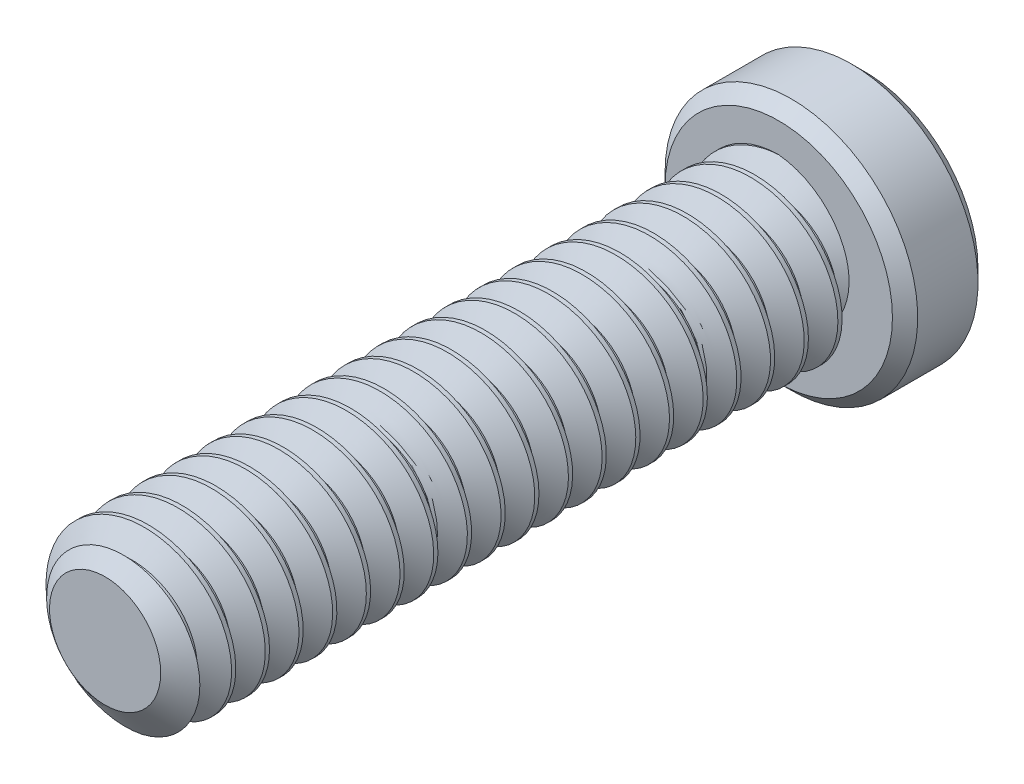
from build123d import *

# Parameters (mm, degrees)
SKETCH1_R          = 3.175
EXTRUDE1_DEPTH     = 25.4
CUT_SWEEP1_PITCH   = 1.27
SKETCH6_R          = 4.7625
EXTRUDE2_DEPTH     = 3.2258
CUT_EXTRUDE1_DEPTH = 2.38125
CHAMFER1_SIZE      = 0.47625


with BuildPart() as part:
    # Sketch1 → Extrude1 (new body)
    with BuildSketch(Plane.XY):
        Circle(SKETCH1_R)
    extrude(amount=-EXTRUDE1_DEPTH)

    # Cut-Sweep1: the profile of Sketch3 profile screwed along a right-hand helix of 21 turns, 6 arcs to a turn; built about Z, then put on its axis
    cut_sweep1_z = Axis((0, 0, 0), (0, 0, 1))
    cut_sweep1_corners = [(3.1753, 0, -1.111423205), (2.350110803, 0, -0.635), (2.350110803, 0, -0.47625), (3.1753, 0, 0.000173205)]
    with BuildLine(mode=Mode.PRIVATE) as cut_sweep1_profile:
        Line(cut_sweep1_corners[0], cut_sweep1_corners[1])
        Line(cut_sweep1_corners[1], cut_sweep1_corners[2])
        Line(cut_sweep1_corners[2], cut_sweep1_corners[3])
        Line(cut_sweep1_corners[3], cut_sweep1_corners[0])
    cut_sweep1_cap = Face(cut_sweep1_profile.wire())
    cut_sweep1_turn_angles = [0, 30, 60, 90, 120, 150, 180, 210, 240, 270, 300, 330, 360]
    cut_sweep1_turn_weights = [1, 0.8660254037844387, 1, 0.8660254037844387, 1, 0.8660254037844387, 1, 0.8660254037844387, 1, 0.8660254037844387, 1, 0.8660254037844387, 1]
    cut_sweep1_turn_rails = [Edge.make_bspline([Vector(p[0], p[1], 0).rotate(cut_sweep1_z, cut_sweep1_turn_angles[k]) / cut_sweep1_turn_weights[k] + Vector(0, 0, p[2] + CUT_SWEEP1_PITCH * cut_sweep1_turn_angles[k] / 360) for k in range(13)], [0, 0, 0, 1, 1, 2, 2, 3, 3, 4, 4, 5, 5, 6, 6, 6], 2, cut_sweep1_turn_weights) for p in cut_sweep1_corners]
    cut_sweep1_turn_sides = [Face.make_surface_from_curves(cut_sweep1_turn_rails[p[0]], cut_sweep1_turn_rails[p[1]]) for p in [(0, 1), (1, 2), (2, 3), (3, 0)]]
    cut_sweep1 = Plane(origin=(0, 0, 0), x_dir=(0, 1, 0), z_dir=(0, 0, -1)) * Solid(Shell([*[p.moved(Location((0, 0, CUT_SWEEP1_PITCH * i))) for i in range(21) for p in cut_sweep1_turn_sides], cut_sweep1_cap, cut_sweep1_cap.rotate(cut_sweep1_z, 7560).moved(Location((0, 0, CUT_SWEEP1_PITCH * 7560 / 360)))]))
    add(cut_sweep1, mode=Mode.SUBTRACT)

    # Sketch4 → Cut-Revolve1 (revolve, cut)
    with BuildSketch(Plane(origin=(0, 0, 0), x_dir=(0, 0, -1), z_dir=(1, 0, 0)), mode=Mode.PRIVATE) as cut_revolve1_sk:
        Polygon((0.755446349, 3.175), (0, 2.096110803), (0, 3.175), align=None)
    revolve(cut_revolve1_sk.sketch.rotate(Axis((0, 0, 0), (0, 0, -1)), 270), axis=Axis((0, 0, 0), (0, 0, -1)), mode=Mode.SUBTRACT)

    # Sketch6 → Extrude2 (add)
    with BuildSketch(Plane(origin=(0, 0, -25.4), x_dir=(-1, 0, 0), z_dir=(0, 0, -1))):
        Circle(SKETCH6_R)
    extrude(amount=EXTRUDE2_DEPTH)

    # Sketch7 → Cut-Extrude1 (cut)
    with BuildSketch(Plane(origin=(0, 0, -28.6258), x_dir=(-1, 0, 0), z_dir=(0, 0, -1))):
        Polygon((0, 1.833087105), (-1.5875, 0.916543552), (-1.5875, -0.916543552), (0, -1.833087105), (1.5875, -0.916543552), (1.5875, 0.916543552), align=None)
    extrude(amount=-CUT_EXTRUDE1_DEPTH, mode=Mode.SUBTRACT)

    # Cut-Extrude2 cone 1 section (through the dimple's axis) → Cut-Extrude2 (revolve, cut)
    with BuildSketch(Plane(origin=(0, 0, -28.6258), x_dir=(0, 1, 0), z_dir=(1, 0, 0))):
        Polygon((0, 0), (1.833087105, 0), (0, 1.833087105), align=None)
    revolve(axis=Axis((0, 0, -28.6258), (0, 0, 1)), mode=Mode.SUBTRACT)

    # Chamfer1
    chamfer1_edges = [part.edges().sort_by_distance(p)[0] for p in [
        (4.7625, 0, -25.4),
        (4.7625, 0, -28.6258),
    ]]
    chamfer(chamfer1_edges, length=CHAMFER1_SIZE)


solid = part.part
